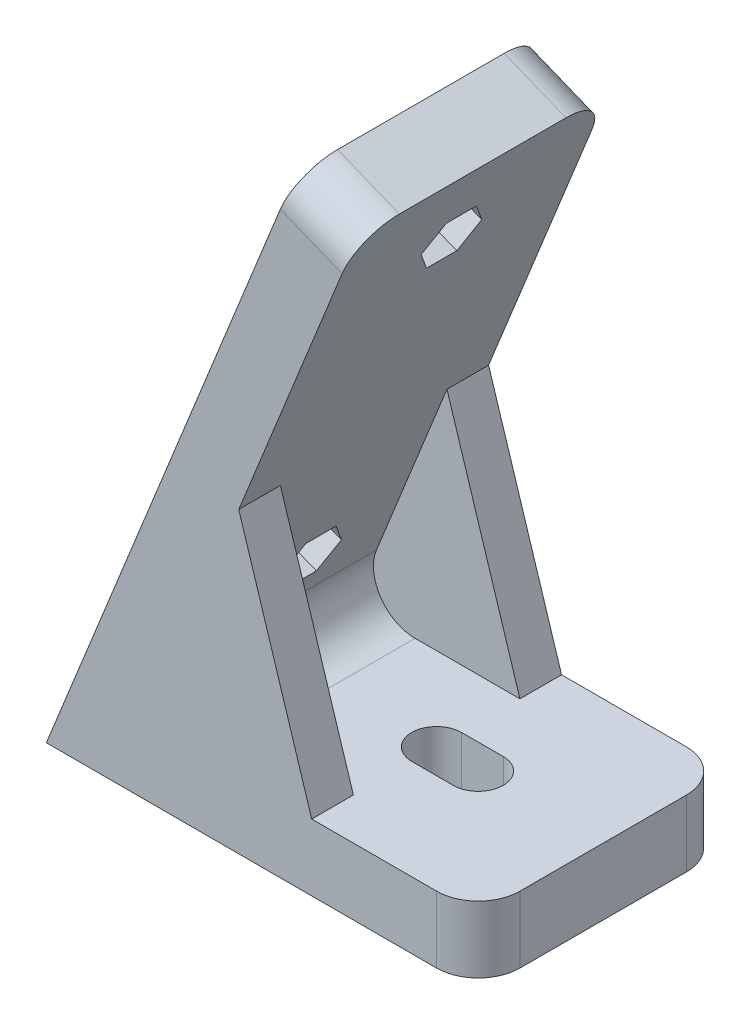
from build123d import *

# Parameters (mm, degrees)
BOSS_EXTRUDE1_DEPTH           = 15
CUT_EXTRUDE1_DEPTH            = 86.172406393
RIB1_REACH                    = 97.349
SKETCH4_WALL_W                = 221.86049538
SKETCH4_WALL_H                = 5
M3_CLEARANCE_HOLE1_AT_2_COUNT = 2
M3_CLEARANCE_HOLE1_AT_2_PITCH = 45
CUT_EXTRUDE2_DEPTH            = 3
FILLET1_R                     = 5
FILLET2_R                     = 5


with BuildPart() as part:
    # Sketch1 → Boss-Extrude1 (new, symmetric)
    with BuildSketch(Plane.XY):
        Polygon((0, 0), (29.968527473, 74.174708365), (37.38599831, 71.177855618), (11.860487748, 8), (51.860487748, 8), (51.860487748, 0), align=None)
    extrude(amount=BOSS_EXTRUDE1_DEPTH, both=True)

    # Sketch2 → Cut-Extrude1 (cut, through all)
    with BuildSketch(Plane(origin=(0.379940125, 8, 0), x_dir=(1, 0, 0), z_dir=(0, 1, 0))):
        with BuildLine():
            Line((36.480547623, -3), (31.480547623, -3))
            ThreePointArc((31.480547623, -3), (28.480547623, 0), (31.480547623, 3))
            Line((31.480547623, 3), (36.480547623, 3))
            ThreePointArc((36.480547623, 3), (39.480547623, 0), (36.480547623, -3))
        make_face()
    extrude(amount=-CUT_EXTRUDE1_DEPTH, mode=Mode.SUBTRACT)

    # Sketch4 wall → Rib1 (add, up to next)
    with BuildSketch(Plane(origin=(27.479586649, 21.907757818, 15), x_dir=(0.300443914696, -0.953799483184, 0), z_dir=(0.953799483184, 0.300443914696, 0)), mode=Mode.PRIVATE) as rib1_sk1:
        with Locations((0, 2.5)):
            Rectangle(SKETCH4_WALL_W, SKETCH4_WALL_H)
    rib1_tool1 = extrude(rib1_sk1.sketch, amount=-RIB1_REACH, mode=Mode.PRIVATE) - part.part
    rib1 = rib1_tool1.solids().sort_by_distance((27.479586649, 21.907757818, 15))[0]
    add(rib1)

    # Mirror1: Rib1 across plane
    add(rib1.mirror(Plane.XY))

    # Sketch7 → M3 Clearance Hole1 (revolve, cut)
    with BuildSketch(Plane(origin=(33.639932376, 61.906017072, 0), x_dir=(0.37460659341591607, 0.9271838545667858, 0), z_dir=(0, 0, 1))):
        Polygon((0, 0), (0, 35.786334818), (1.7, 35.786334818), (1.7, 0.025), (1.725, 0), align=None)
    m3_clearance_hole1 = revolve(axis=Axis((39.527549852, 59.527265204, 0), (-0.9271838545667859, 0.37460659341591607, 0)), mode=Mode.SUBTRACT)

    # M3 Clearance Hole1 at 2: M3 Clearance Hole1 ×2
    with Locations(*[Vector(-0.37460659341591607, -0.9271838545667859, 0) * (i * M3_CLEARANCE_HOLE1_AT_2_PITCH) for i in range(1, M3_CLEARANCE_HOLE1_AT_2_COUNT)]):
        add(m3_clearance_hole1, mode=Mode.SUBTRACT)

    # Sketch8 → Cut-Extrude2 (cut)
    with BuildSketch(Plane(origin=(7.417470837, -2.996852747, 0), x_dir=(0, 0, -1), z_dir=(0.9271838545667858, -0.37460659341591607, 0))):
        Polygon((3.637306696, 70), (1.818653348, 73.15), (-1.818653348, 73.15), (-3.637306696, 70), (-1.818653348, 66.85), (1.818653348, 66.85), align=None)
        Polygon((3.637306696, 25), (1.818653348, 28.15), (-1.818653348, 28.15), (-3.637306696, 25), (-1.818653348, 21.85), (1.818653348, 21.85), align=None)
    extrude(amount=-CUT_EXTRUDE2_DEPTH, mode=Mode.SUBTRACT)

    # Fillet1
    fillet1_edges = [part.edges().sort_by_distance(p)[0] for p in [
        (11.860487748, 8, 0),
    ]]
    fillet(fillet1_edges, radius=FILLET1_R)

    # Fillet2
    fillet2_edges = [part.edges().sort_by_distance(p)[0] for p in [
        (33.677262892, 72.676281992, -15),
        (33.677262892, 72.676281992, 15),
        (51.860487748, 4, -15),
        (51.860487748, 4, 15),
    ]]
    fillet(fillet2_edges, radius=FILLET2_R)


solid = part.part
